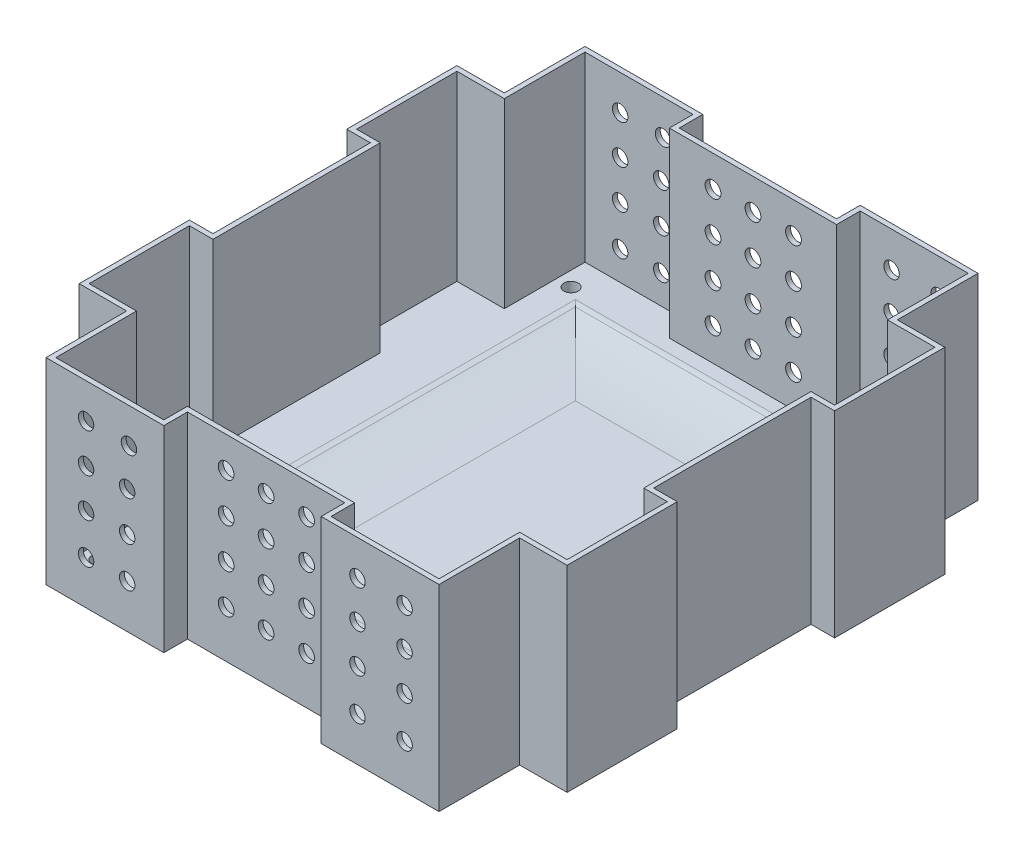
from build123d import *

# Parameters (mm, degrees)
SKETCH1_R               = 2.286
MAIN_BODY_DEPTH         = 1.5875
WALLS_DEPTH             = 63.5
WALLS_START             = 4.7625
WALLS_CUT_OUT_DEPTH     = 58.7375
CUT_EXTRUDE4_DEPTH      = 134.418018367
CUT_EXTRUDE4_DEPTH_BACK = 134.418018367
SKETCH1_8_R             = 2.286
CROSS_BRACE_DEPTH       = 1.5875
HOLES_MIDDLE_DEPTH      = 194.353329183
HOLES_MIDDLE_DEPTH_BACK = 194.353329183
SKETCH8_R               = 2.545226629
HOLES_SIDE_DEPTH        = 202.257938229
HOLES_SIDE_DEPTH_BACK   = 202.257938229
SKETCH9_R               = 2.499157901
FILLET2_RADIUS          = 4.064
FILLET2_LENGTH          = 1.5875
FILLET3_R               = 4.064
CUT_EXTRUDE8_DEPTH      = 134.418018367
CUT_EXTRUDE8_DEPTH_BACK = 134.418018367
SKETCH1_12_R            = 2.286
FILLET4_RADIUS          = 4.064
FILLET4_LENGTH          = 1.5875
FILLET5_RADIUS          = 4.064
FILLET5_LENGTH          = 1.5875
SKETCH11_W              = 104.01974769
SKETCH11_H              = 144.943029272
TAPER_MIDDLE_DEPTH      = 3.175
TAPER_MIDDLE_DRAFT      = -74.999999999
FILLET6_R               = 93.82
FILLET7_R               = 7.46


# Read off the part's stored shape, not the designer's step: walls cut out
# Some blends are built 0.0001 mm under size
with BuildPart() as part:
    # Sketch1 → Main Body (new body)
    with BuildSketch(Plane(origin=(0, 0, 0), x_dir=(1, 0, 0), z_dir=(0, 1, 0))):
        Polygon((-25.4, 86.995), (-63.43142, 86.995), (-63.43142, 60.96), (-78.74, 60.96), (-78.74, 25.4), (-71.12, 25.4), (-71.12, -25.4), (-78.74, -25.4), (-78.74, -60.96), (-63.43142, -60.96), (-63.43142, -86.995), (-25.4, -86.995), (-25.4, -79.375), (25.4, -79.375), (25.4, -86.995), (63.43142, -86.995), (63.43142, -60.96), (78.74, -60.96), (78.74, -25.4), (71.12, -25.4), (71.12, 25.4), (78.74, 25.4), (78.74, 60.96), (63.43142, 60.96), (63.43142, 86.995), (25.4, 86.995), (25.4, 79.375), (-25.4, 79.375), align=None)
        with Locations(Location((-57.15, 76.2, 0), (0, 0, 270))):
            Circle(SKETCH1_R, mode=Mode.SUBTRACT)
        with Locations(Location((57.15, 76.2, 0), (0, 0, 270))):
            Circle(SKETCH1_R, mode=Mode.SUBTRACT)
        with Locations(Location((57.15, -76.2, 0), (0, 0, 270))):
            Circle(SKETCH1_R, mode=Mode.SUBTRACT)
        with Locations(Location((-57.15, -76.2, 0), (0, 0, 270))):
            Circle(SKETCH1_R, mode=Mode.SUBTRACT)
    extrude(amount=MAIN_BODY_DEPTH)

    # Sketch1<7> → walls (add)
    with BuildSketch(Plane(origin=(0, 0, 0), x_dir=(1, 0, 0), z_dir=(0, 1, 0))):
        Polygon((-25.4, 86.995), (-63.43142, 86.995), (-63.43142, 60.96), (-78.74, 60.96), (-78.74, 25.4), (-71.12, 25.4), (-71.12, -25.4), (-78.74, -25.4), (-78.74, -60.96), (-63.43142, -60.96), (-63.43142, -86.995), (-25.4, -86.995), (-25.4, -79.375), (25.4, -79.375), (25.4, -86.995), (63.43142, -86.995), (63.43142, -60.96), (78.74, -60.96), (78.74, -25.4), (71.12, -25.4), (71.12, 25.4), (78.74, 25.4), (78.74, 60.96), (63.43142, 60.96), (63.43142, 86.995), (25.4, 86.995), (25.4, 79.375), (-25.4, 79.375), align=None)
    extrude(amount=WALLS_DEPTH)

    # walls cut out outline → walls cut out (cut)
    with BuildSketch(Plane(origin=(0, 0, 0), x_dir=(1, 0, 0), z_dir=(0, 1, 0)).offset(WALLS_START)):
        Polygon((-77.1525, -26.9875), (-77.1525, -59.3725), (-61.84392, -59.3725), (-61.84392, -85.4075), (-26.9875, -85.4075), (-26.9875, -77.7875), (26.9875, -77.7875), (26.9875, -85.4075), (61.84392, -85.4075), (61.84392, -59.3725), (77.1525, -59.3725), (77.1525, -26.9875), (69.5325, -26.9875), (69.5325, 26.9875), (77.1525, 26.9875), (77.1525, 59.3725), (61.84392, 59.3725), (61.84392, 85.4075), (26.9875, 85.4075), (26.9875, 77.7875), (-26.9875, 77.7875), (-26.9875, 85.4075), (-61.84392, 85.4075), (-61.84392, 59.3725), (-77.1525, 59.3725), (-77.1525, 26.9875), (-69.5325, 26.9875), (-69.5325, -26.9875), align=None)
    extrude(amount=WALLS_CUT_OUT_DEPTH, mode=Mode.SUBTRACT)

    # Sketch1<8> → Cut-Extrude4 (cut, two sides: drawn at the far end of the back side and taken through both)
    with BuildSketch(Plane(origin=(0, 0, 0), x_dir=(1, 0, 0), z_dir=(0, 1, 0)).offset(-CUT_EXTRUDE4_DEPTH_BACK)):
        with Locations(Location((-57.15, 76.2, 0), (0, 0, 270))):
            Circle(SKETCH1_8_R)
        with Locations(Location((57.15, 76.2, 0), (0, 0, 270))):
            Circle(SKETCH1_8_R)
        with Locations(Location((57.15, -76.2, 0), (0, 0, 270))):
            Circle(SKETCH1_8_R)
        with Locations(Location((-57.15, -76.2, 0), (0, 0, 270))):
            Circle(SKETCH1_8_R)
    extrude(amount=CUT_EXTRUDE4_DEPTH + CUT_EXTRUDE4_DEPTH_BACK, mode=Mode.SUBTRACT)

    # Sketch10 → cross brace (add)
    with BuildSketch(Plane.XZ):
        Polygon((-56.184799984, -81.686399979), (0, -6.773333333), (56.124409067, -81.605878755), (62.749026436, -76.892035248), (5.08, 0), (62.687200182, 76.809600242), (56.184799818, 81.686399758), (0, 6.773333333), (-56.184799962, 81.686399949), (-62.687200038, 76.809600051), (-5.08, 0), (-62.687200016, -76.809600021), align=None)
    extrude(amount=CROSS_BRACE_DEPTH)

    # Sketch8 → holes-middle (cut, two sides: drawn at the far end of the back side and taken through both)
    with BuildSketch(Plane(origin=(0, 0, 77.7875), x_dir=(-1, 0, 0), z_dir=(0, 0, -1)).offset(-HOLES_MIDDLE_DEPTH_BACK)):
        with Locations(Location((0, 27.857460193, 0), (0, 0, 180))):
            Circle(SKETCH8_R)
        with Locations(Location((0, 15.219093486, 0), (0, 0, 180))):
            Circle(SKETCH8_R)
        with Locations(Location((0, 40.671359771, 0), (0, 0, 180))):
            Circle(SKETCH8_R)
        with Locations(Location((-13.077198884, 27.857460193, 0), (0, 0, 180))):
            Circle(SKETCH8_R)
        with Locations(Location((-13.077198884, 15.219093486, 0), (0, 0, 180))):
            Circle(SKETCH8_R)
        with Locations(Location((12.901666013, 15.219093486, 0), (0, 0, 180))):
            Circle(SKETCH8_R)
        with Locations(Location((12.901666013, 40.671359771, 0), (0, 0, 180))):
            Circle(SKETCH8_R)
        with Locations(Location((12.901666013, 27.857460193, 0), (0, 0, 180))):
            Circle(SKETCH8_R)
        with Locations(Location((-13.077198884, 40.671359771, 0), (0, 0, 180))):
            Circle(SKETCH8_R)
        with Locations(Location((-13.077198884, 53.416438943, 0), (0, 0, 180))):
            Circle(SKETCH8_R)
        with Locations(Location((0, 53.416438943, 0), (0, 0, 180))):
            Circle(SKETCH8_R)
        with Locations(Location((12.901666013, 53.416438943, 0), (0, 0, 180))):
            Circle(SKETCH8_R)
    extrude(amount=HOLES_MIDDLE_DEPTH + HOLES_MIDDLE_DEPTH_BACK, mode=Mode.SUBTRACT)

    # Sketch9 → holes-side (cut, two sides: drawn at the far end of the back side and taken through both)
    with BuildSketch(Plane.XY.offset(86.995).offset(-HOLES_SIDE_DEPTH_BACK)):
        with Locations((-50.495622987, 27.1034668)):
            Circle(SKETCH9_R)
        with Locations((-50.495622987, 39.636115396)):
            Circle(SKETCH9_R)
        with Locations((-50.495622987, 14.084113403)):
            Circle(SKETCH9_R)
        with Locations((-37.232917191, 39.879467796)):
            Circle(SKETCH9_R)
        with Locations((-37.232917191, 27.1034668)):
            Circle(SKETCH9_R)
        with Locations((-37.232917191, 14.084113403)):
            Circle(SKETCH9_R)
        with Locations((37.111240991, 39.879467796)):
            Circle(SKETCH9_R)
        with Locations((37.111240991, 27.468495399)):
            Circle(SKETCH9_R)
        with Locations((37.111240991, 14.084113403)):
            Circle(SKETCH9_R)
        with Locations((52.320765987, 39.879467796)):
            Circle(SKETCH9_R)
        with Locations((52.320765987, 27.468495399)):
            Circle(SKETCH9_R)
        with Locations((52.320765987, 14.084113403)):
            Circle(SKETCH9_R)
        with Locations((52.320765987, 52.07151745)):
            Circle(SKETCH9_R)
        with Locations((37.111240991, 52.07151745)):
            Circle(SKETCH9_R)
        with Locations((-50.495622987, 52.206009599)):
            Circle(SKETCH9_R)
        with Locations((-36.649110701, 52.206009599)):
            Circle(SKETCH9_R)
    extrude(amount=HOLES_SIDE_DEPTH + HOLES_SIDE_DEPTH_BACK, mode=Mode.SUBTRACT)

    # Fillet2: full round fillet: the end face becomes a half cylinder, R = half its width
    fillet2_face = Plane((-59.436, -0.79375, 79.248), x_dir=(0, 1, 0), z_dir=(-0.59999998746, 0, 0.800000009405))  # on the end face: x along it, z out of the body
    fillet2_slab = fillet2_face.offset(-FILLET2_RADIUS / 2) * Box(FILLET2_LENGTH, 2 * FILLET2_RADIUS, FILLET2_RADIUS, mode=Mode.PRIVATE)  # the body's end, R deep
    fillet2_round = Plane((-56.997600051, -0.79375, 75.996799962), x_dir=(-0.59999998746, 0, 0.800000009405), z_dir=(0, 1, 0)) * Cylinder(FILLET2_RADIUS, FILLET2_LENGTH, mode=Mode.PRIVATE)  # its axis R under the face
    add(fillet2_slab - fillet2_round, mode=Mode.SUBTRACT)

    # Fillet3
    fillet3_edges = [part.edges().sort_by_distance(p)[0] for p in [
        (56.124409067, -0.79375, -81.605878755),
        (62.749026436, -0.79375, -76.892035248),
    ]]
    fillet(fillet3_edges, radius=FILLET3_R - 0.0001)  # a hair under: the kernel refuses the full size

    # Sketch1<12> → Cut-Extrude8 (cut, two sides: drawn at the far end of the back side and taken through both)
    with BuildSketch(Plane(origin=(0, 0, 0), x_dir=(1, 0, 0), z_dir=(0, 1, 0)).offset(-CUT_EXTRUDE8_DEPTH_BACK)):
        with Locations(Location((-57.15, 76.2, 0), (0, 0, 270))):
            Circle(SKETCH1_12_R)
        with Locations(Location((57.15, 76.2, 0), (0, 0, 270))):
            Circle(SKETCH1_12_R)
        with Locations(Location((57.15, -76.2, 0), (0, 0, 270))):
            Circle(SKETCH1_12_R)
        with Locations(Location((-57.15, -76.2, 0), (0, 0, 270))):
            Circle(SKETCH1_12_R)
    extrude(amount=CUT_EXTRUDE8_DEPTH + CUT_EXTRUDE8_DEPTH_BACK, mode=Mode.SUBTRACT)

    # Fillet4: full round fillet: the end face becomes a half cylinder, R = half its width
    fillet4_face = Plane((-59.436, -0.79375, -79.248), x_dir=(0, 1, 0), z_dir=(-0.599999994776, 0, -0.800000003918))  # on the end face: x along it, z out of the body
    fillet4_slab = fillet4_face.offset(-FILLET4_RADIUS / 2) * Box(FILLET4_LENGTH, 2 * FILLET4_RADIUS, FILLET4_RADIUS, mode=Mode.PRIVATE)  # the body's end, R deep
    fillet4_round = Plane((-56.997600021, -0.79375, -75.996799984), x_dir=(-0.599999994776, 0, -0.800000003918), z_dir=(0, 1, 0)) * Cylinder(FILLET4_RADIUS, FILLET4_LENGTH, mode=Mode.PRIVATE)  # its axis R under the face
    add(fillet4_slab - fillet4_round, mode=Mode.SUBTRACT)

    # Fillet5: full round fillet: the end face becomes a half cylinder, R = half its width
    fillet5_face = Plane((59.436, -0.79375, 79.248), x_dir=(0, 1, 0), z_dir=(0.599999940349, 0, 0.800000044738))  # on the end face: x along it, z out of the body
    fillet5_slab = fillet5_face.offset(-FILLET5_RADIUS / 2) * Box(FILLET5_LENGTH, 2 * FILLET5_RADIUS, FILLET5_RADIUS, mode=Mode.PRIVATE)  # the body's end, R deep
    fillet5_round = Plane((56.997600242, -0.79375, 75.996799818), x_dir=(0.599999940349, 0, 0.800000044738), z_dir=(0, 1, 0)) * Cylinder(FILLET5_RADIUS, FILLET5_LENGTH, mode=Mode.PRIVATE)  # its axis R under the face
    add(fillet5_slab - fillet5_round, mode=Mode.SUBTRACT)


with BuildPart() as taper_middle_tool:
    # Sketch11 → "taper" middle (with draft: the straight prism first)
    with BuildSketch(Plane(origin=(0, 4.7625, 0), x_dir=(1, 0, 0), z_dir=(0, 1, 0))):
        Rectangle(SKETCH11_W, SKETCH11_H)
    extrude(amount=-TAPER_MIDDLE_DEPTH)
    # "taper" middle: the draft: its side faces are tilted about the plane it starts from
    taper_middle_sides = [taper_middle_tool.faces().sort_by_distance(p)[0] for p in [
        (-52.009873845, 3.175, 0),
        (0, 3.175, 72.471514636),
        (52.009873845, 3.175, 0),
        (0, 3.175, -72.471514636),
    ]]
    draft(taper_middle_sides, Plane(origin=(0, 4.7625, 0), x_dir=(1, 0, 0), z_dir=(0, 1, 0)), TAPER_MIDDLE_DRAFT)


with BuildPart() as part_1:
    add(part.part)

    # "taper" middle: cut by taper_middle_tool
    add(taper_middle_tool.part, mode=Mode.SUBTRACT)

    # Fillet6
    # the kernel refuses this fillet: 93.82 mm, written as the material it adds along each edge
    with BuildSketch(Plane(origin=(-40.160612531, 1.5875, -91.501346633), x_dir=(-0.9659258262864808, 0.2588190451121773, 0), z_dir=(0, 0, 1))) as fillet6_piece_1_section:
        with BuildLine():
            CenterArc((FILLET6_R * 0.131652497592, -FILLET6_R), FILLET6_R, 90, 15.000000001)
            Line((-FILLET6_R * 0.12716654752, -FILLET6_R * 0.0340741737135), (0, 0))
            Line((0, 0), (FILLET6_R * 0.131652497592, 0))
        make_face()
    fillet6_piece_1 = extrude(amount=183.002693267, mode=Mode.PRIVATE)
    fillet6_piece_1 = split(fillet6_piece_1, bisect_by=Plane(origin=(-40.532801069, 4.7625, 0), z_dir=(0, -1, 0)), keep=Keep.TOP, mode=Mode.PRIVATE)
    fillet6_piece_1 = split(fillet6_piece_1, bisect_by=Plane(origin=(-40.532801069, -13.565197132, -4.071617758), z_dir=(0, 0.9659258262864809, 0.2588190451121768)), keep=Keep.TOP, mode=Mode.PRIVATE)
    fillet6_piece_1 = split(fillet6_piece_1, bisect_by=Plane(origin=(-40.532801069, -13.565197132, 4.071617758), z_dir=(0, 0.9659258262864809, -0.2588190451121768)), keep=Keep.TOP, mode=Mode.PRIVATE)
    add(fillet6_piece_1)
    with BuildSketch(Plane(origin=(-71.039705841, 1.5875, 60.622253323), x_dir=(0, 0.25881904511217635, 0.965925826286481), z_dir=(1, 0, 0))) as fillet6_piece_2_section:
        with BuildLine():
            CenterArc((FILLET6_R * 0.131652497592, -FILLET6_R), FILLET6_R, 90, 15.000000001)
            Line((-FILLET6_R * 0.12716654752, -FILLET6_R * 0.0340741737135), (0, 0))
            Line((0, 0), (FILLET6_R * 0.131652497592, 0))
        make_face()
    fillet6_piece_2 = extrude(amount=142.079411683, mode=Mode.PRIVATE)
    fillet6_piece_2 = split(fillet6_piece_2, bisect_by=Plane(origin=(0, 4.7625, 61.182297062), z_dir=(0, -1, 0)), keep=Keep.TOP, mode=Mode.PRIVATE)
    fillet6_piece_2 = split(fillet6_piece_2, bisect_by=Plane(origin=(-2.711273737, -8.447020087, 61.182297062), z_dir=(0.2588190451121768, 0.9659258262864809, 0)), keep=Keep.TOP, mode=Mode.PRIVATE)
    fillet6_piece_2 = split(fillet6_piece_2, bisect_by=Plane(origin=(2.711273737, -8.447020087, 61.182297062), z_dir=(-0.2588190451121768, 0.9659258262864809, 0)), keep=Keep.TOP, mode=Mode.PRIVATE)
    add(fillet6_piece_2)
    with BuildSketch(Plane(origin=(40.160612531, 1.5875, 91.501346633), x_dir=(0.9659258262864807, 0.2588190451121775, 0), z_dir=(0, 0, -1))) as fillet6_piece_3_section:
        with BuildLine():
            CenterArc((FILLET6_R * 0.131652497592, -FILLET6_R), FILLET6_R, 90, 15.000000001)
            Line((-FILLET6_R * 0.12716654752, -FILLET6_R * 0.0340741737135), (0, 0))
            Line((0, 0), (FILLET6_R * 0.131652497592, 0))
        make_face()
    fillet6_piece_3 = extrude(amount=183.002693267, mode=Mode.PRIVATE)
    fillet6_piece_3 = split(fillet6_piece_3, bisect_by=Plane(origin=(40.532801069, 4.7625, 0), z_dir=(0, -1, 0)), keep=Keep.TOP, mode=Mode.PRIVATE)
    fillet6_piece_3 = split(fillet6_piece_3, bisect_by=Plane(origin=(40.532801069, -13.565197132, 4.071617758), z_dir=(0, 0.9659258262864809, -0.2588190451121768)), keep=Keep.TOP, mode=Mode.PRIVATE)
    fillet6_piece_3 = split(fillet6_piece_3, bisect_by=Plane(origin=(40.532801069, -13.565197132, -4.071617758), z_dir=(0, 0.9659258262864809, 0.2588190451121768)), keep=Keep.TOP, mode=Mode.PRIVATE)
    add(fillet6_piece_3)
    with BuildSketch(Plane(origin=(71.039705841, 1.5875, -60.622253323), x_dir=(0, 0.25881904511217635, -0.965925826286481), z_dir=(-1, 0, 0))) as fillet6_piece_4_section:
        with BuildLine():
            CenterArc((FILLET6_R * 0.131652497592, -FILLET6_R), FILLET6_R, 90, 15.000000001)
            Line((-FILLET6_R * 0.12716654752, -FILLET6_R * 0.0340741737135), (0, 0))
            Line((0, 0), (FILLET6_R * 0.131652497592, 0))
        make_face()
    fillet6_piece_4 = extrude(amount=142.079411683, mode=Mode.PRIVATE)
    fillet6_piece_4 = split(fillet6_piece_4, bisect_by=Plane(origin=(0, 4.7625, -61.182297062), z_dir=(0, -1, 0)), keep=Keep.TOP, mode=Mode.PRIVATE)
    fillet6_piece_4 = split(fillet6_piece_4, bisect_by=Plane(origin=(-2.711273737, -8.447020087, -61.182297062), z_dir=(0.2588190451121768, 0.9659258262864809, 0)), keep=Keep.TOP, mode=Mode.PRIVATE)
    fillet6_piece_4 = split(fillet6_piece_4, bisect_by=Plane(origin=(2.711273737, -8.447020087, -61.182297062), z_dir=(-0.2588190451121768, 0.9659258262864809, 0)), keep=Keep.TOP, mode=Mode.PRIVATE)
    add(fillet6_piece_4)

    # Fillet7
    fillet7_edges = [part_1.edges().sort_by_distance(p)[0] for p in [
        (-52.009726745, 4.7625, 0),
        (0, 4.7625, 72.471367537),
        (52.009726745, 4.7625, 0),
        (0, 4.7625, -72.471367537),
    ]]
    fillet(fillet7_edges, radius=FILLET7_R)


solid = part_1.part
